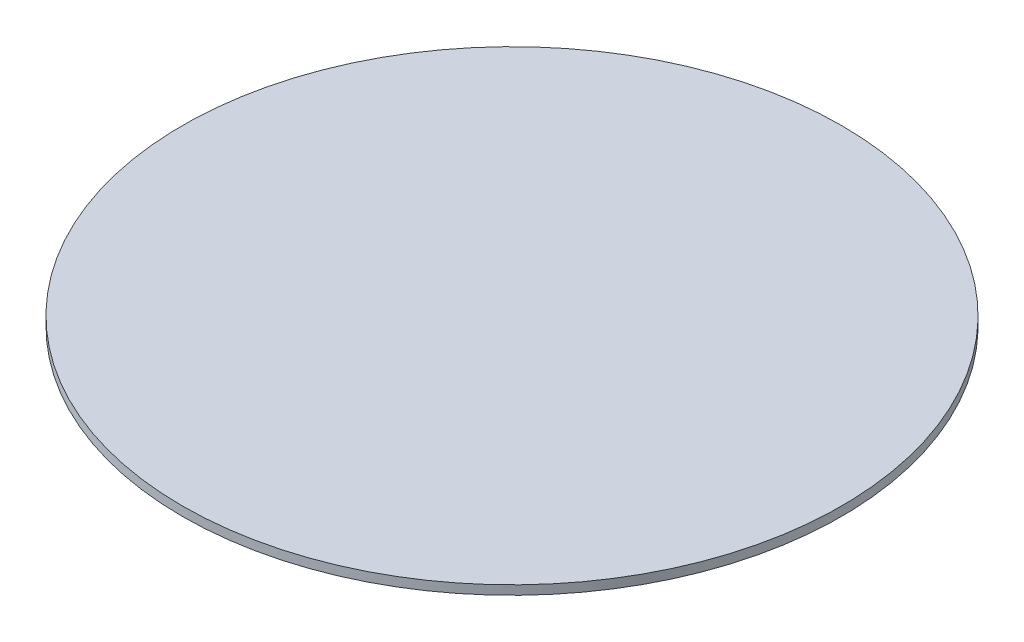
from build123d import *

# Parameters (mm, degrees)
SKETCH_2_R      = 72.5
EXTRUDE_1_DEPTH = 2


with BuildPart() as part:
    # 草图2 → 凸台-拉伸1 (new body)
    with BuildSketch(Plane(origin=(0, 0, 0), x_dir=(1, 0, 0), z_dir=(0, 1, 0))):
        Circle(SKETCH_2_R)
    extrude(amount=EXTRUDE_1_DEPTH)


solid = part.part
